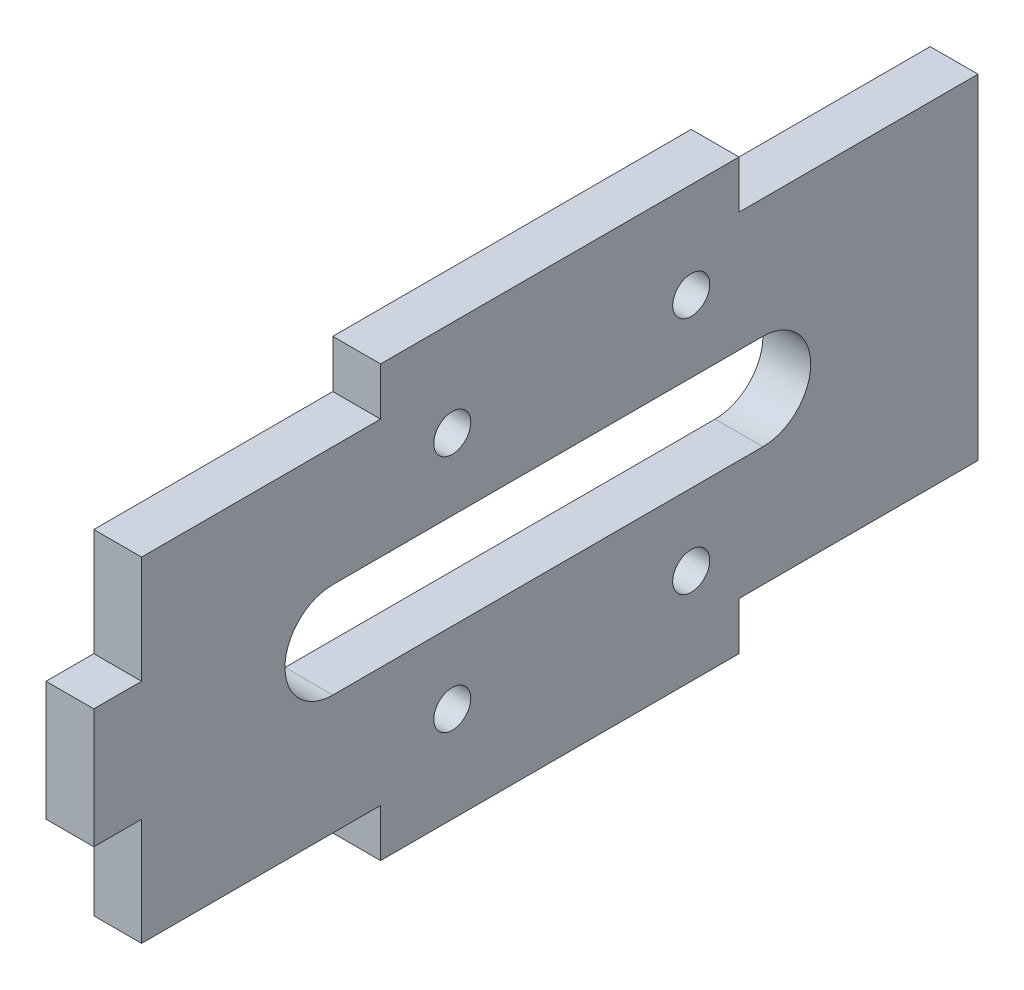
from build123d import *

# Parameters (mm, degrees)
GRUNDPLATTE_DEPTH               = 4
SKIZZE2_W                       = 20
SKIZZE2_H                       = 4
SCHNITT_LINEAR_AUSTRAGEN1_DEPTH = 77.26270386
SKIZZE4_R                       = 1.55
SCHNITT_LINEAR_AUSTRAGEN3_DEPTH = 10
SCHNITT_LINEAR_AUSTRAGEN5_DEPTH = 10


with BuildPart() as part:
    # Skizze1 → Grundplatte (new body)
    with BuildSketch(Plane(origin=(0, 0, 0), x_dir=(0, 0, -1), z_dir=(1, 0, 0))):
        Polygon((0, -5), (0, 5), (4, 5), (4, 18), (74, 18), (74, -18), (4, -18), (4, -5), align=None)
    extrude(amount=GRUNDPLATTE_DEPTH)

    # Skizze2 → Schnitt-Linear austragen1 (cut, through all)
    with BuildSketch(Plane(origin=(4, 0, 0), x_dir=(0, 0, -1), z_dir=(1, 0, 0))):
        with Locations((14, 16)):
            Rectangle(SKIZZE2_W, SKIZZE2_H)
        with Locations((64, 16)):
            Rectangle(SKIZZE2_W, SKIZZE2_H)
        with Locations((64, -16)):
            Rectangle(SKIZZE2_W, SKIZZE2_H)
        with Locations((14, -16)):
            Rectangle(SKIZZE2_W, SKIZZE2_H)
    extrude(amount=-SCHNITT_LINEAR_AUSTRAGEN1_DEPTH, mode=Mode.SUBTRACT)

    # Skizze4 → Schnitt-Linear austragen3 (cut)
    with BuildSketch(Plane(origin=(4, 0, 0), x_dir=(0, 0, -1), z_dir=(1, 0, 0))):
        with Locations((50, 10)):
            Circle(SKIZZE4_R)
        with Locations((30, 10)):
            Circle(SKIZZE4_R)
        with Locations((30, -10)):
            Circle(SKIZZE4_R)
        with Locations((50, -10)):
            Circle(SKIZZE4_R)
    extrude(amount=-SCHNITT_LINEAR_AUSTRAGEN3_DEPTH, mode=Mode.SUBTRACT)

    # Skizze6 → Schnitt-Linear austragen5 (cut)
    with BuildSketch(Plane(origin=(4, 0, 0), x_dir=(0, 0, -1), z_dir=(1, 0, 0))):
        with BuildLine():
            Line((20, 4), (56, 4))
            ThreePointArc((56, 4), (60, 0), (56, -4))
            Line((56, -4), (20, -4))
            ThreePointArc((20, -4), (16, 0), (20, 4))
        make_face()
    extrude(amount=-SCHNITT_LINEAR_AUSTRAGEN5_DEPTH, mode=Mode.SUBTRACT)


solid = part.part
